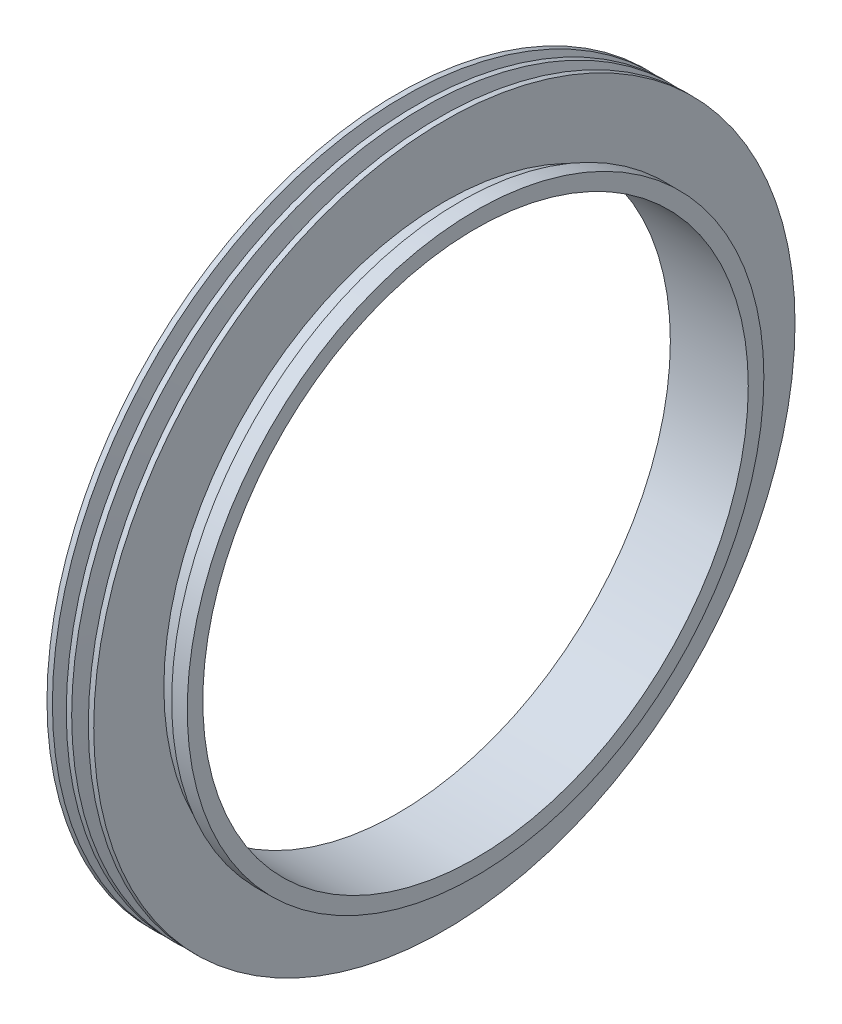
from build123d import *


with BuildPart() as part:
    # Szkic1 → Obrót1 (revolve)
    with BuildSketch(Plane.XY):
        Polygon((-5, 17.5), (0, 17.5), (0, 18.5), (-1, 18.5), (-1, 18), (-2, 18), (-2, 22.5), (-2.347434939, 22.5), (-2.899277053, 20.911565577), (-3.101574823, 20.911565577), (-3.415520415, 22.5), (-3.762955354, 22.5), (-4.081701013, 20.911565577), (-4.283998784, 20.911565577), (-4.652565061, 22.5), (-5, 22.5), align=None)
    revolve(axis=Axis((0, 0, 0), (-1, 0, 0)))


solid = part.part
